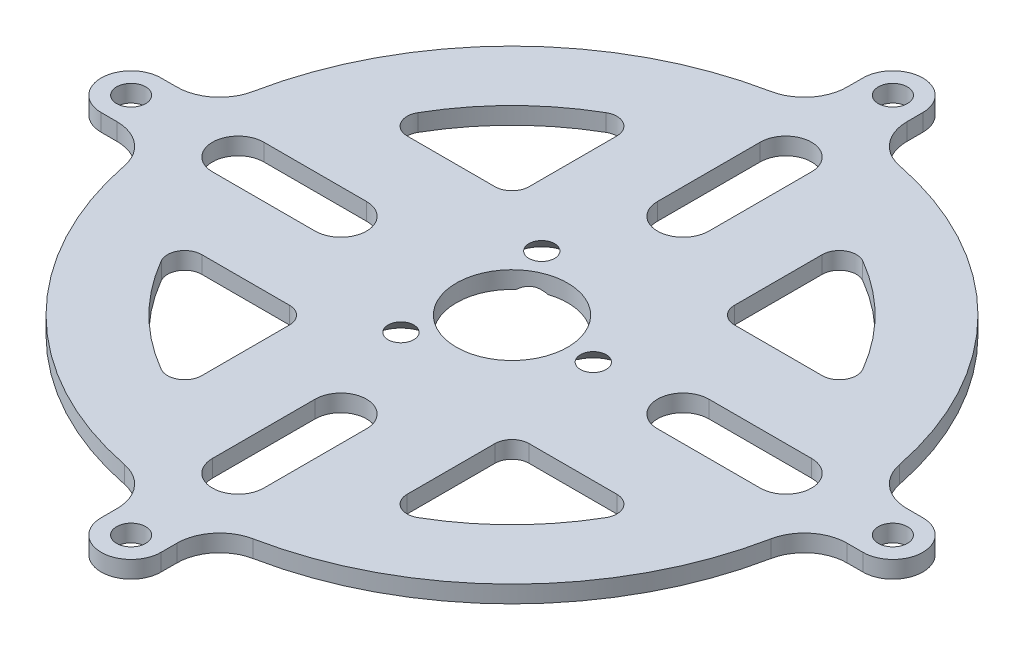
from build123d import *

# Parameters (mm, degrees)
SKETCH_2_R          = 38.5
SKETCH_2_R_2        = 6.5
SKETCH_2_R_3        = 1.5
EXTRUDE_1_DEPTH     = 2
CHAMFER_1_SIZE      = 2
CHAMFER_1_SIZE_2    = 1.93137755
SKETCH_3_R          = 1.7
EXTRUDE_2_DEPTH     = 2
FILLET_1_R          = 5
CUT_EXTRUDE_1_DEPTH = 10
FILLET_2_R          = 2
CUT_EXTRUDE_4_DEPTH = 10


with BuildPart() as part:
    # 草图2 → 凸台-拉伸1 (new body)
    with BuildSketch(Plane(origin=(0, 0, 0), x_dir=(1, 0, 0), z_dir=(0, 1, 0))):
        with Locations(Location((0, 0, 0), (0, 0, 270))):
            Circle(SKETCH_2_R)
        with Locations(Location((0, 0, 0), (0, 0, 270))):
            Circle(SKETCH_2_R_2, mode=Mode.SUBTRACT)
        with Locations(Location((9.5, 0, 0), (0, 0, 270))):
            Circle(SKETCH_2_R_3, mode=Mode.SUBTRACT)
        with Locations(Location((-4.75, -8.227241336, 0), (0, 0, 270))):
            Circle(SKETCH_2_R_3, mode=Mode.SUBTRACT)
        with Locations(Location((-4.75, 8.227241336, 0), (0, 0, 270))):
            Circle(SKETCH_2_R_3, mode=Mode.SUBTRACT)
    extrude(amount=EXTRUDE_1_DEPTH)

    # 倒角1
    # the kernel refuses this chamfer: 2, 1.93137755 mm, written as the material it takes off along each edge
    with BuildSketch(Plane(origin=(-4.75, 0, 8.227241336), x_dir=(0, 0, 1), z_dir=(-1, 0, 0))) as chamfer_1_piece_1:
        Polygon((1.5, CHAMFER_1_SIZE), (1.5 + CHAMFER_1_SIZE_2, 0), (1.5, 0), align=None)
    revolve(axis=Axis((-4.75, 0, 8.227241336), (0, 1, 0)), mode=Mode.SUBTRACT)
    with BuildSketch(Plane(origin=(-4.75, 0, -8.227241336), x_dir=(0, 0, 1), z_dir=(-1, 0, 0))) as chamfer_1_piece_2:
        Polygon((1.5, CHAMFER_1_SIZE), (1.5 + CHAMFER_1_SIZE_2, 0), (1.5, 0), align=None)
    revolve(axis=Axis((-4.75, 0, -8.227241336), (0, 1, 0)), mode=Mode.SUBTRACT)
    with BuildSketch(Plane(origin=(9.5, 0, 0), x_dir=(0, 0, 1), z_dir=(-1, 0, 0))) as chamfer_1_piece_3:
        Polygon((1.5, CHAMFER_1_SIZE), (1.5 + CHAMFER_1_SIZE_2, 0), (1.5, 0), align=None)
    revolve(axis=Axis((9.5, 0, 0), (0, 1, 0)), mode=Mode.SUBTRACT)

    # 草图3 → 凸台-拉伸2 (add)
    # profile 1 of 4: a face of its own
    with BuildSketch(Plane(origin=(0, 0, 0), x_dir=(1, 0, 0), z_dir=(0, 1, 0))):
        with BuildLine():
            Line((44.5, 3.5), (38.340579025, 3.5))
            ThreePointArc((38.340579025, 3.5), (38.5, 0), (38.340579025, -3.5))
            Line((38.340579025, -3.5), (44.5, -3.5))
            ThreePointArc((44.5, -3.5), (48, 0), (44.5, 3.5))
        make_face()
        with Locations(Location((44.5, 0, 0), (0, 0, 270))):
            Circle(SKETCH_3_R, mode=Mode.SUBTRACT)
    # profile 2 of 4: a face of its own
    with BuildSketch(Plane(origin=(0, 0, 0), x_dir=(1, 0, 0), z_dir=(0, 1, 0))):
        with BuildLine():
            Line((-3.5, 44.5), (-3.5, 38.340579025))
            ThreePointArc((-3.5, 38.340579025), (0, 38.5), (3.5, 38.340579025))
            Line((3.5, 38.340579025), (3.5, 44.5))
            ThreePointArc((3.5, 44.5), (0, 48), (-3.5, 44.5))
        make_face()
        with Locations(Location((0, 44.5, 0), (0, 0, 270))):
            Circle(SKETCH_3_R, mode=Mode.SUBTRACT)
    # profile 3 of 4: a face of its own
    with BuildSketch(Plane(origin=(0, 0, 0), x_dir=(1, 0, 0), z_dir=(0, 1, 0))):
        with BuildLine():
            Line((3.5, -44.5), (3.5, -38.340579025))
            ThreePointArc((3.5, -38.340579025), (0, -38.5), (-3.5, -38.340579025))
            Line((-3.5, -38.340579025), (-3.5, -44.5))
            ThreePointArc((-3.5, -44.5), (0, -48), (3.5, -44.5))
        make_face()
        with Locations(Location((0, -44.5, 0), (0, 0, 270))):
            Circle(SKETCH_3_R, mode=Mode.SUBTRACT)
    # profile 4 of 4: a face of its own
    with BuildSketch(Plane(origin=(0, 0, 0), x_dir=(1, 0, 0), z_dir=(0, 1, 0))):
        with BuildLine():
            Line((-44.5, -3.5), (-38.340579025, -3.5))
            ThreePointArc((-38.340579025, -3.5), (-38.5, 0), (-38.340579025, 3.5))
            Line((-38.340579025, 3.5), (-44.5, 3.5))
            ThreePointArc((-44.5, 3.5), (-48, 0), (-44.5, -3.5))
        make_face()
        with Locations(Location((-44.5, 0, 0), (0, 0, 270))):
            Circle(SKETCH_3_R, mode=Mode.SUBTRACT)
    extrude(amount=EXTRUDE_2_DEPTH)

    # 圆角1
    fillet_1_edges = [part.edges().sort_by_distance(p)[0] for p in [
        (38.340579025, 1, -3.5),
        (38.340579025, 1, 3.5),
        (-3.5, 1, -38.340579025),
        (3.5, 1, -38.340579025),
        (3.5, 1, 38.340579025),
        (-3.5, 1, 38.340579025),
        (-38.340579025, 1, 3.5),
        (-38.340579025, 1, -3.5),
    ]]
    fillet(fillet_1_edges, radius=FILLET_1_R)

    # 草图4 → 切除-拉伸1 (cut)
    with BuildSketch(Plane(origin=(0, 2, 0), x_dir=(1, 0, 0), z_dir=(0, 1, 0))):
        with BuildLine():
            Line((-12, 27.49545417), (-12, 12))
            Line((-12, 12), (-27.49545417, 12))
            ThreePointArc((-27.49545417, 12), (-21.213203436, 21.213203436), (-12, 27.49545417))
        make_face()
        with BuildLine():
            Line((-27.49545417, -12), (-12, -12))
            Line((-12, -12), (-12, -27.49545417))
            ThreePointArc((-12, -27.49545417), (-21.213203436, -21.213203436), (-27.49545417, -12))
        make_face()
        with BuildLine():
            Line((12, 27.49545417), (12, 12))
            Line((12, 12), (27.49545417, 12))
            ThreePointArc((27.49545417, 12), (21.213203436, 21.213203436), (12, 27.49545417))
        make_face()
        with BuildLine():
            Line((12, -12), (12, -27.49545417))
            ThreePointArc((12, -27.49545417), (21.213203436, -21.213203436), (27.49545417, -12))
            Line((27.49545417, -12), (12, -12))
        make_face()
    extrude(amount=-CUT_EXTRUDE_1_DEPTH, mode=Mode.SUBTRACT)

    # 圆角2
    fillet_2_edges = [part.edges().sort_by_distance(p)[0] for p in [
        (-12, 1, 27.49545417),
        (-27.49545417, 1, 12),
        (-12, 1, 12),
        (12, 1, -27.49545417),
        (27.49545417, 1, -12),
        (12, 1, -12),
        (27.49545417, 1, 12),
        (12, 1, 27.49545417),
        (12, 1, 12),
        (-27.49545417, 1, -12),
        (-12, 1, -27.49545417),
        (-12, 1, -12),
    ]]
    fillet(fillet_2_edges, radius=FILLET_2_R)

    # 草图5 → 切除-拉伸4 (cut)
    with BuildSketch(Plane(origin=(0, 2, 0), x_dir=(1, 0, 0), z_dir=(0, 1, 0))):
        with BuildLine():
            Line((3, 32), (3, 20))
            ThreePointArc((3, 20), (0, 17), (-3, 20))
            Line((-3, 20), (-3, 32))
            ThreePointArc((-3, 32), (0, 35), (3, 32))
        make_face()
        with BuildLine():
            Line((32, 3), (20, 3))
            ThreePointArc((20, 3), (17, 0), (20, -3))
            Line((20, -3), (32, -3))
            ThreePointArc((32, -3), (35, 0), (32, 3))
        make_face()
        with BuildLine():
            Line((-3, -32), (-3, -20))
            ThreePointArc((-3, -20), (0, -17), (3, -20))
            Line((3, -20), (3, -32))
            ThreePointArc((3, -32), (0, -35), (-3, -32))
        make_face()
        with BuildLine():
            Line((-32, -3), (-20, -3))
            ThreePointArc((-20, -3), (-17, 0), (-20, 3))
            Line((-20, 3), (-32, 3))
            ThreePointArc((-32, 3), (-35, 0), (-32, -3))
        make_face()
    extrude(amount=-CUT_EXTRUDE_4_DEPTH, mode=Mode.SUBTRACT)


solid = part.part
